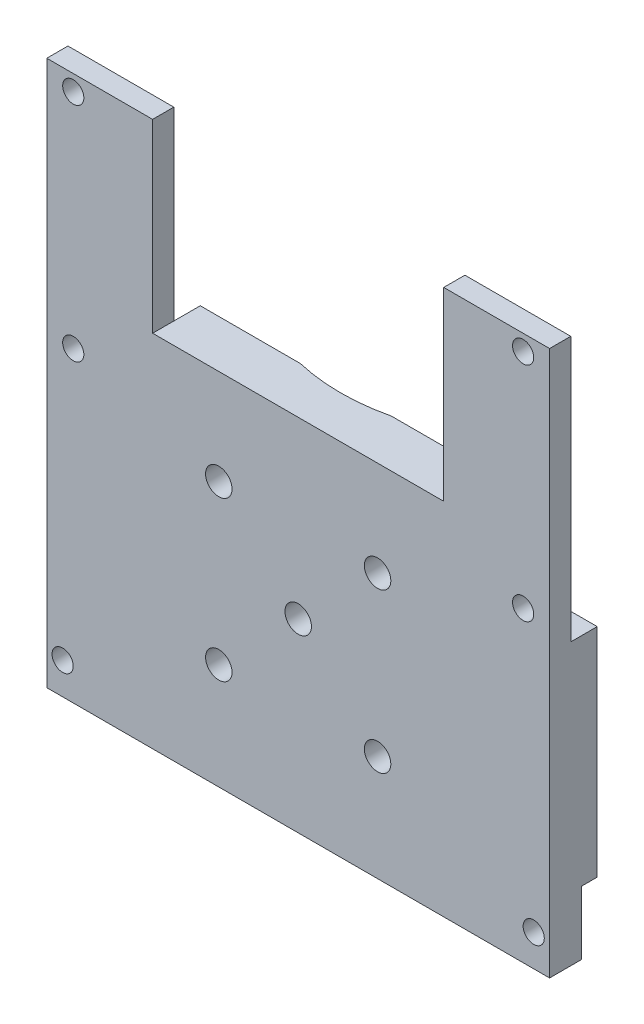
from build123d import *

# Parameters (mm, degrees)
SKETCH1_R                = 37.5
BOSS_EXTRUDE1_DEPTH      = 12
SKETCH2_R                = 30
BOSS_EXTRUDE2_DEPTH      = 56
BOSS_EXTRUDE3_DEPTH      = 5
BOSS_EXTRUDE3_DEPTH_BACK = 1
SKETCH4_W                = 75
SKETCH4_H                = 15
SKETCH4_R                = 3.5
MOVE_FACE3_BY            = 10
MOVE_FACE3_2_BY          = 10
BOSS_EXTRUDE4_DEPTH      = 12
BOSS_EXTRUDE5_DEPTH      = 68
MOVE_START               = 42.5
MOVE_FACE1_OUTLINE_W     = 95
MOVE_FACE1_OUTLINE_H     = 83
MOVE_FACE1_OUTLINE_R     = 3.5
MOVE_FACE1_DEPTH         = 10
SKETCH11_W               = 95
SKETCH11_H               = 15
BOSS_EXTRUDE7_DEPTH      = 20
CUT_EXTRUDE1_DEPTH       = 103.720494547
CUT_EXTRUDE1_DEPTH_BACK  = 103.720494547
SKETCH12_R               = 2.5
SKETCH13_R               = 6.5
CUT_EXTRUDE2_DEPTH       = 5
MOVE_FACE2_BY            = 7
DELETEFACE1_START        = -20
DELETEFACE1_OUTLINE_W    = 95
DELETEFACE1_OUTLINE_H    = 8
DELETEFACE1_DEPTH        = 20
CUT_EXTRUDE3_DEPTH       = 103.359660059
CUT_EXTRUDE3_DEPTH_BACK  = 3
SKETCH15_R               = 2
CUT_EXTRUDE4_DEPTH       = 96.818839484
MOVE_FACE4_BY            = 20
SKETCH16_W               = 55
SKETCH16_H               = 35
CUT_EXTRUDE5_DEPTH       = 10
SKETCH17_W               = 20
SKETCH17_H               = 50
CUT_EXTRUDE6_DEPTH       = 5
SKETCH18_R               = 2
CUT_EXTRUDE7_DEPTH       = 114.535236825
SKETCH19_R               = 2.5
CUT_EXTRUDE8_DEPTH       = 114.781589028


# Read off the part's stored shape, not the designer's step: Move Face1, DeleteFace1
with BuildPart() as part:
    # Sketch1 → Boss-Extrude1 (new body)
    with BuildSketch(Plane(origin=(0, 0, 0), x_dir=(1, 0, 0), z_dir=(0, 1, 0))):
        with Locations(Location((0, 0, 0), (0, 0, 270))):
            Circle(SKETCH1_R)
    extrude(amount=BOSS_EXTRUDE1_DEPTH)

    # Sketch2 → Boss-Extrude2 (add)
    with BuildSketch(Plane(origin=(0, 12, 0), x_dir=(1, 0, 0), z_dir=(0, 1, 0))):
        with Locations(Location((0, 0, 0), (0, 0, 270))):
            Circle(SKETCH2_R)
    extrude(amount=BOSS_EXTRUDE2_DEPTH)


with BuildPart() as body_2:
    # Sketch4 → Boss-Extrude3 (new, two sides: drawn at the far end of the back side and taken through both)
    with BuildSketch(Plane.XY.offset(37.5).offset(-BOSS_EXTRUDE3_DEPTH_BACK)):
        with Locations((0, 75.5)):
            Rectangle(SKETCH4_W, SKETCH4_H)
        with Locations((0, 76)):
            Circle(SKETCH4_R, mode=Mode.SUBTRACT)
    extrude(amount=BOSS_EXTRUDE3_DEPTH + BOSS_EXTRUDE3_DEPTH_BACK)

    # Move Face3: a face moved outward by 10.0
    extrude(body_2.faces().sort_by_distance((-37.5, 75.5, 39.5))[0], amount=MOVE_FACE3_BY, dir=(-1, 0, 0))

    # Move Face3 2: a face moved outward by 10.0
    extrude(body_2.faces().sort_by_distance((37.5, 75.5, 39.5))[0], amount=MOVE_FACE3_2_BY, dir=(1, 0, 0))



with BuildPart() as body_3:
    # Sketch6 → Boss-Extrude4 (new body)
    with BuildSketch(Plane.XZ):
        with BuildLine():
            Line((42.5, 0), (37.5, 0))
            ThreePointArc((37.5, 0), (0, 37.5), (-37.5, 0))
            Line((-37.5, 0), (-42.5, 0))
            ThreePointArc((-42.5, 0), (0, 42.5), (42.5, 0))
        make_face()
    extrude(amount=-BOSS_EXTRUDE4_DEPTH)


with BuildPart() as body_2_1:
    add(body_2.part)

    add(body_3.part)  # Boss-Extrude5 merges body 3
    # Sketch7 → Boss-Extrude5 (add)
    with BuildSketch(Plane.XZ.offset(-68)):
        with BuildLine():
            Line((8.602325267, 36.5), (47.5, 36.5))
            Line((47.5, 36.5), (47.5, 42.5))
            Line((47.5, 42.5), (-47.5, 42.5))
            Line((-47.5, 42.5), (-47.5, 36.5))
            Line((-47.5, 36.5), (-8.602325267, 36.5))
            ThreePointArc((-8.602325267, 36.5), (0, 37.5), (8.602325267, 36.5))
        make_face()
    extrude(amount=BOSS_EXTRUDE5_DEPTH)

    # Move Face1 outline → Move Face1 (add)
    with BuildSketch(Plane.XY.offset(MOVE_START)):
        with Locations((0, 41.5)):
            Rectangle(MOVE_FACE1_OUTLINE_W, MOVE_FACE1_OUTLINE_H)
        with Locations((0, 76)):
            Circle(MOVE_FACE1_OUTLINE_R, mode=Mode.SUBTRACT)
    extrude(amount=MOVE_FACE1_DEPTH)

    # Sketch11 → Boss-Extrude7 (add)
    with BuildSketch(Plane.XZ):
        with Locations((0, 45)):
            Rectangle(SKETCH11_W, SKETCH11_H)
    extrude(amount=BOSS_EXTRUDE7_DEPTH)

    # Sketch12 → Cut-Extrude1 (cut, two sides: drawn at the far end of the back side and taken through both)
    with BuildSketch(Plane(origin=(0, 0, 37.5), x_dir=(-1, 0, 0), z_dir=(0, 0, -1)).offset(-CUT_EXTRUDE1_DEPTH_BACK)):
        with Locations((-15, 20)):
            Circle(SKETCH12_R)
        with Locations((15, 20)):
            Circle(SKETCH12_R)
        with Locations((-15, 50)):
            Circle(SKETCH12_R)
        with Locations((15, 50)):
            Circle(SKETCH12_R)
    extrude(amount=CUT_EXTRUDE1_DEPTH + CUT_EXTRUDE1_DEPTH_BACK, mode=Mode.SUBTRACT)

    # Sketch13 → Cut-Extrude2 (cut)
    with BuildSketch(Plane(origin=(0, 0, 36.5), x_dir=(-1, 0, 0), z_dir=(0, 0, -1))):
        with Locations((-15, 50)):
            Circle(SKETCH13_R)
        with Locations((15, 50)):
            Circle(SKETCH13_R)
        with Locations((-15, 20)):
            Circle(SKETCH13_R)
        with Locations((15, 20)):
            Circle(SKETCH13_R)
    extrude(amount=-CUT_EXTRUDE2_DEPTH, mode=Mode.SUBTRACT)

    # Move Face2: a face moved inward by 7.0
    extrude(body_2_1.faces().sort_by_distance((0, 31.294429556, 52.5))[0], amount=MOVE_FACE2_BY, dir=(0, 0, -1), mode=Mode.SUBTRACT)

    # DeleteFace1 outline → DeleteFace1 (cut)
    with BuildSketch(Plane(origin=(0, 0, 0), x_dir=(1, 0, 0), z_dir=(0, 1, 0)).offset(DELETEFACE1_START)):
        with Locations((0, -41.5)):
            Rectangle(DELETEFACE1_OUTLINE_W, DELETEFACE1_OUTLINE_H)
    extrude(amount=DELETEFACE1_DEPTH, mode=Mode.SUBTRACT)

    # Sketch14 → Cut-Extrude3 (cut, two sides: drawn at the far end of the back side and taken through both)
    with BuildSketch(Plane(origin=(0, 0, 36.5), x_dir=(-1, 0, 0), z_dir=(0, 0, -1)).offset(-CUT_EXTRUDE3_DEPTH_BACK)):
        Polygon((47.5, 0), (-42.5, 0), (-47.5, 0), (-47.5, 12), (-42.5, 12), (47.5, 12), align=None)
    extrude(amount=CUT_EXTRUDE3_DEPTH + CUT_EXTRUDE3_DEPTH_BACK, mode=Mode.SUBTRACT)

    # Sketch15 → Cut-Extrude4 (cut, through all)
    with BuildSketch(Plane(origin=(0, 0, 39.5), x_dir=(-1, 0, 0), z_dir=(0, 0, -1))):
        with Locations((44.5, 6)):
            Circle(SKETCH15_R)
        with Locations((-44.5, 6)):
            Circle(SKETCH15_R)
    extrude(amount=-CUT_EXTRUDE4_DEPTH, mode=Mode.SUBTRACT)

    # Move Face4: a face moved outward by 20.0
    extrude(body_2_1.faces().sort_by_distance((0, 83, 41))[0], amount=MOVE_FACE4_BY, dir=(0, 1, 0))

    # Sketch16 → Cut-Extrude5 (cut)
    with BuildSketch(Plane(origin=(0, 0, 36.5), x_dir=(-1, 0, 0), z_dir=(0, 0, -1))):
        with Locations((0, 85.5)):
            Rectangle(SKETCH16_W, SKETCH16_H)
    extrude(amount=-CUT_EXTRUDE5_DEPTH, mode=Mode.SUBTRACT)

    # Sketch17 → Cut-Extrude6 (cut)
    with BuildSketch(Plane(origin=(0, 0, 36.5), x_dir=(-1, 0, 0), z_dir=(0, 0, -1))):
        with Locations((37.5, 78)):
            Rectangle(SKETCH17_W, SKETCH17_H)
        with Locations((-37.5, 78)):
            Rectangle(SKETCH17_W, SKETCH17_H)
    extrude(amount=-CUT_EXTRUDE6_DEPTH, mode=Mode.SUBTRACT)

    # Sketch18 → Cut-Extrude7 (cut, through all)
    with BuildSketch(Plane(origin=(0, 0, 41.5), x_dir=(-1, 0, 0), z_dir=(0, 0, -1))):
        with Locations((-42.5, 58)):
            Circle(SKETCH18_R)
        with Locations((-42.5, 100)):
            Circle(SKETCH18_R)
        with Locations(Location((42.5, 100, 0), (0, 0, 180))):
            Circle(SKETCH18_R)
        with Locations(Location((42.5, 58, 0), (0, 0, 180))):
            Circle(SKETCH18_R)
    extrude(amount=-CUT_EXTRUDE7_DEPTH, mode=Mode.SUBTRACT)

    # Sketch19 → Cut-Extrude8 (cut, through all)
    with BuildSketch(Plane.XY.offset(45.5)):
        with Locations((0, 35)):
            Circle(SKETCH19_R)
    extrude(amount=-CUT_EXTRUDE8_DEPTH, mode=Mode.SUBTRACT)


solid = body_2_1.part
